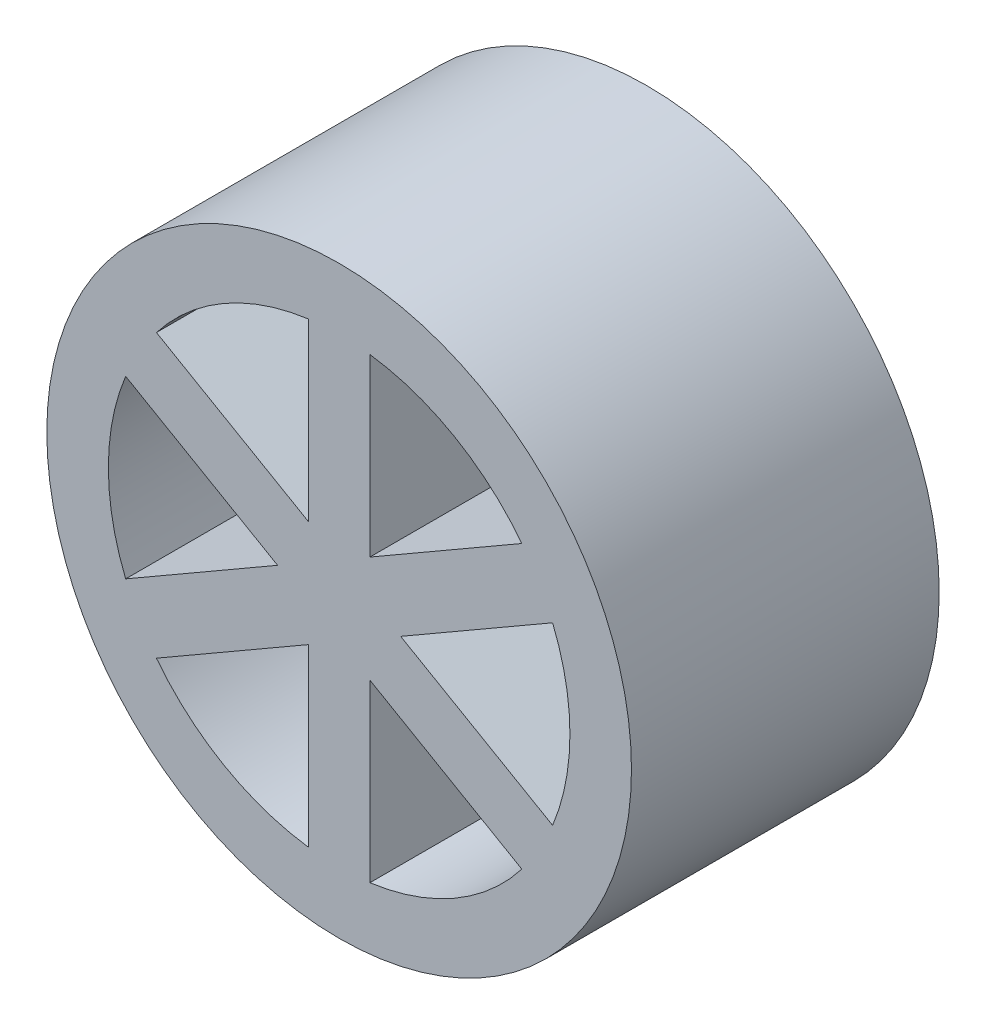
from build123d import *

# Parameters (mm, degrees)
SZKIC1_R                    = 9.5
DODANIE_WYCI_GNI_CIE1_DEPTH = 10
SZKIC2_R                    = 2
DODANIE_WYCI_GNI_CIE2_DEPTH = 5


with BuildPart() as part:
    # Szkic1 → Dodanie-wyciągnięcie1 (new body)
    with BuildSketch(Plane.XY):
        Circle(SZKIC1_R)
        with BuildLine():
            Line((-2, 0), (-6.937196595, -2.850491783))
            ThreePointArc((-6.937196595, -2.850491783), (-7.5, 0), (-6.937196595, 2.850491783))
            Line((-6.937196595, 2.850491783), (-2, 0))
        make_face(mode=Mode.SUBTRACT)
        with BuildLine():
            Line((-5.937196595, -4.582542591), (-1, -1.732050808))
            Line((-1, -1.732050808), (-1, -7.433034374))
            ThreePointArc((-1, -7.433034374), (-3.75, -6.495190528), (-5.937196595, -4.582542591))
        make_face(mode=Mode.SUBTRACT)
        with BuildLine():
            ThreePointArc((5.937196595, -4.582542591), (3.75, -6.495190528), (1, -7.433034374))
            Line((1, -7.433034374), (1, -1.732050808))
            Line((1, -1.732050808), (5.937196595, -4.582542591))
        make_face(mode=Mode.SUBTRACT)
        with BuildLine():
            Line((6.937196595, -2.850491783), (2, 0))
            Line((2, 0), (6.937196595, 2.850491783))
            ThreePointArc((6.937196595, 2.850491783), (7.5, 0), (6.937196595, -2.850491783))
        make_face(mode=Mode.SUBTRACT)
        with BuildLine():
            ThreePointArc((1, 7.433034374), (3.75, 6.495190528), (5.937196595, 4.582542591))
            Line((5.937196595, 4.582542591), (1, 1.732050808))
            Line((1, 1.732050808), (1, 7.433034374))
        make_face(mode=Mode.SUBTRACT)
        with BuildLine():
            ThreePointArc((-5.937196595, 4.582542591), (-3.75, 6.495190528), (-1, 7.433034374))
            Line((-1, 7.433034374), (-1, 1.732050808))
            Line((-1, 1.732050808), (-5.937196595, 4.582542591))
        make_face(mode=Mode.SUBTRACT)
    extrude(amount=DODANIE_WYCI_GNI_CIE1_DEPTH)

    # Szkic2 → Dodanie-wyciągnięcie2 (add)
    with BuildSketch(Plane(origin=(0, 0, 0), x_dir=(-1, 0, 0), z_dir=(0, 0, -1))):
        Circle(SZKIC2_R)
    extrude(amount=DODANIE_WYCI_GNI_CIE2_DEPTH)


solid = part.part
